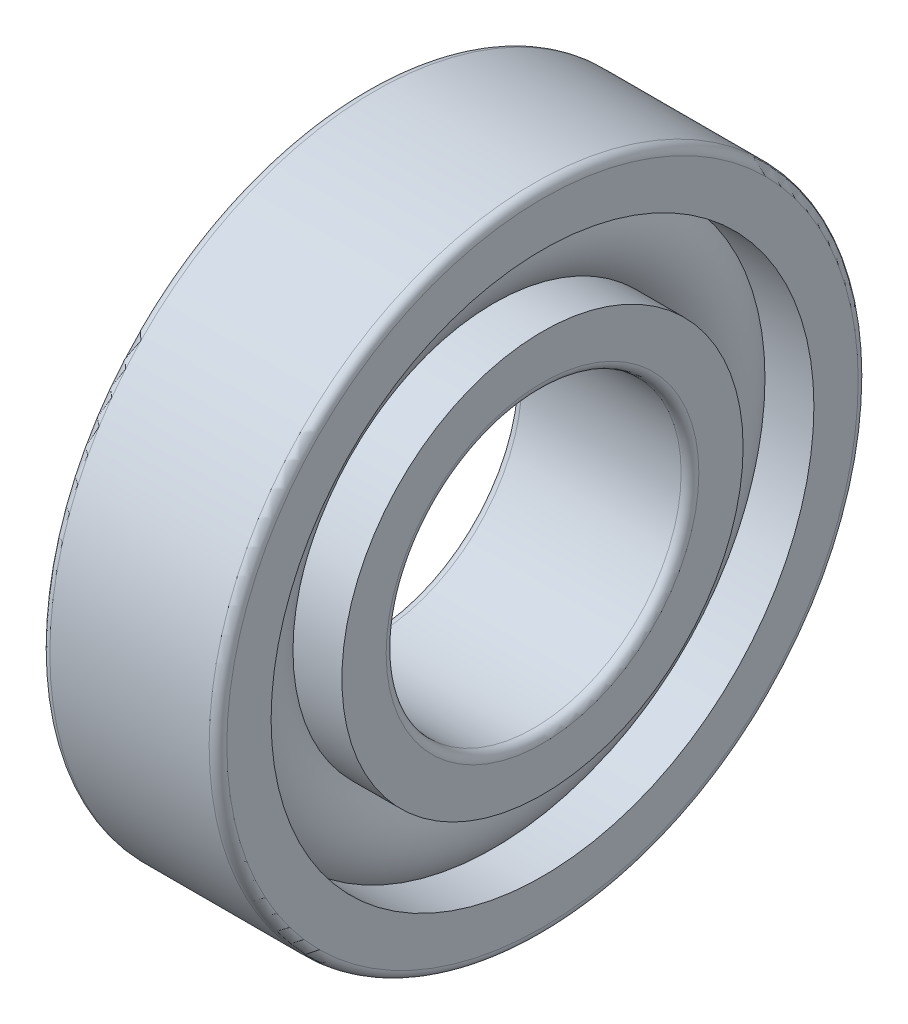
from build123d import *

# Parameters (mm, degrees)
CAGSPISKE_W     = 0.18
CAGSPISKE_H     = 0.3
CAGESPINE_ANGLE = 0.001
BALSIMSKE_R     = 0.9


with BuildPart() as part:
    # CagSpiSke → CageSpine (revolve)
    with BuildSketch(Plane.XY):
        with Locations((0, 4)):
            Rectangle(CAGSPISKE_W, CAGSPISKE_H)
    revolve(axis=Axis((-20.6375, 0, 0), (-1, 0, 0)), revolution_arc=CAGESPINE_ANGLE)

    # BalSimSke → BallsSimplified (revolve)
    with BuildSketch(Plane.XY):
        with Locations((0, 4)):
            Circle(BALSIMSKE_R)
    revolve(axis=Axis((-10, 0, 0), (1, 0, 0)))

    # InnRacSke → InnerRace (revolve)
    with BuildSketch(Plane.XY):
        with BuildLine():
            Line((-0.63688696, 3.4), (-1.5, 3.4))
            Line((-1.5, 3.4), (-1.5, 2.65))
            ThreePointArc((-1.5, 2.65), (-1.456066017, 2.543933983), (-1.35, 2.5))
            Line((-1.35, 2.5), (1.35, 2.5))
            ThreePointArc((1.35, 2.5), (1.456066017, 2.543933983), (1.5, 2.65))
            Line((1.5, 2.65), (1.5, 3.4))
            Line((1.5, 3.4), (0.63688696, 3.4))
            ThreePointArc((0.63688696, 3.4), (0, 3.125), (-0.63688696, 3.4))
        make_face()
    revolve(axis=Axis((-20.6375, 0, 0), (1, 0, 0)))

    # OutRacSke → OuterRace (revolve)
    with BuildSketch(Plane.XY):
        with BuildLine():
            Line((-0.63688696, 4.6), (-1.5, 4.6))
            Line((-1.5, 4.6), (-1.5, 5.35))
            ThreePointArc((-1.5, 5.35), (-1.456066017, 5.456066017), (-1.35, 5.5))
            Line((-1.35, 5.5), (1.35, 5.5))
            ThreePointArc((1.35, 5.5), (1.456066017, 5.456066017), (1.5, 5.35))
            Line((1.5, 5.35), (1.5, 4.6))
            Line((1.5, 4.6), (0.63688696, 4.6))
            ThreePointArc((0.63688696, 4.6), (0, 4.875), (-0.63688696, 4.6))
        make_face()
    revolve(axis=Axis((-20.6375, 0, 0), (1, 0, 0)))


solid = part.part
